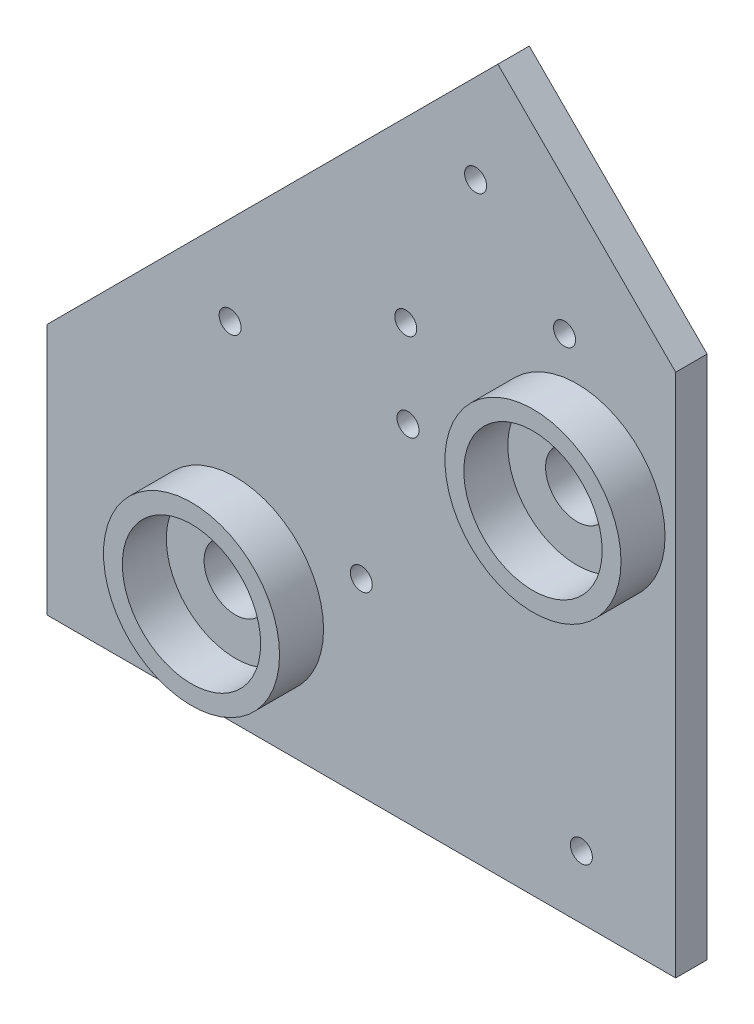
from build123d import *

# Parameters (mm, degrees)
SKETCH1_R           = 1.75
SKETCH1_R_2         = 5
BOSS_EXTRUDE1_DEPTH = 5
SKETCH2_R           = 14
SKETCH2_R_2         = 11
BOSS_EXTRUDE2_DEPTH = 7


with BuildPart() as part:
    # Sketch1 → Boss-Extrude1 (new body)
    with BuildSketch(Plane.XY):
        Polygon((21.715728753, 91.715728753), (-50, 20), (-50, -20), (50, -20), (50, 20), (50, 63.431457505), align=None)
        with Locations((-35, -10)):
            Circle(SKETCH1_R, mode=Mode.SUBTRACT)
        with Locations((-20, 0)):
            Circle(SKETCH1_R_2, mode=Mode.SUBTRACT)
        with Locations((-20.857864376, 35)):
            Circle(SKETCH1_R, mode=Mode.SUBTRACT)
        with Locations((35, -10)):
            Circle(SKETCH1_R, mode=Mode.SUBTRACT)
        with Locations((0, 10)):
            Circle(SKETCH1_R, mode=Mode.SUBTRACT)
        with Locations((7.426406871, 35)):
            Circle(SKETCH1_R, mode=Mode.SUBTRACT)
        with Locations((7.071067812, 48.786796564)):
            Circle(SKETCH1_R, mode=Mode.SUBTRACT)
        with Locations((34.305835412, 40)):
            Circle(SKETCH1_R_2, mode=Mode.SUBTRACT)
        with Locations((32.32233047, 59.895923599)):
            Circle(SKETCH1_R, mode=Mode.SUBTRACT)
        with Locations((18.180194847, 74.038059223)):
            Circle(SKETCH1_R, mode=Mode.SUBTRACT)
    extrude(amount=BOSS_EXTRUDE1_DEPTH)

    # Sketch2 → Boss-Extrude2 (add)
    # profile 1 of 2: a face of its own
    with BuildSketch(Plane.XY.offset(5)):
        with Locations((-20, 0)):
            Circle(SKETCH2_R)
        with Locations((-20, 0)):
            Circle(SKETCH2_R_2, mode=Mode.SUBTRACT)
    # profile 2 of 2: a face of its own
    with BuildSketch(Plane.XY.offset(5)):
        with Locations((34.305835412, 40)):
            Circle(SKETCH2_R)
        with Locations((34.305835412, 40)):
            Circle(SKETCH2_R_2, mode=Mode.SUBTRACT)
    extrude(amount=BOSS_EXTRUDE2_DEPTH)


solid = part.part
